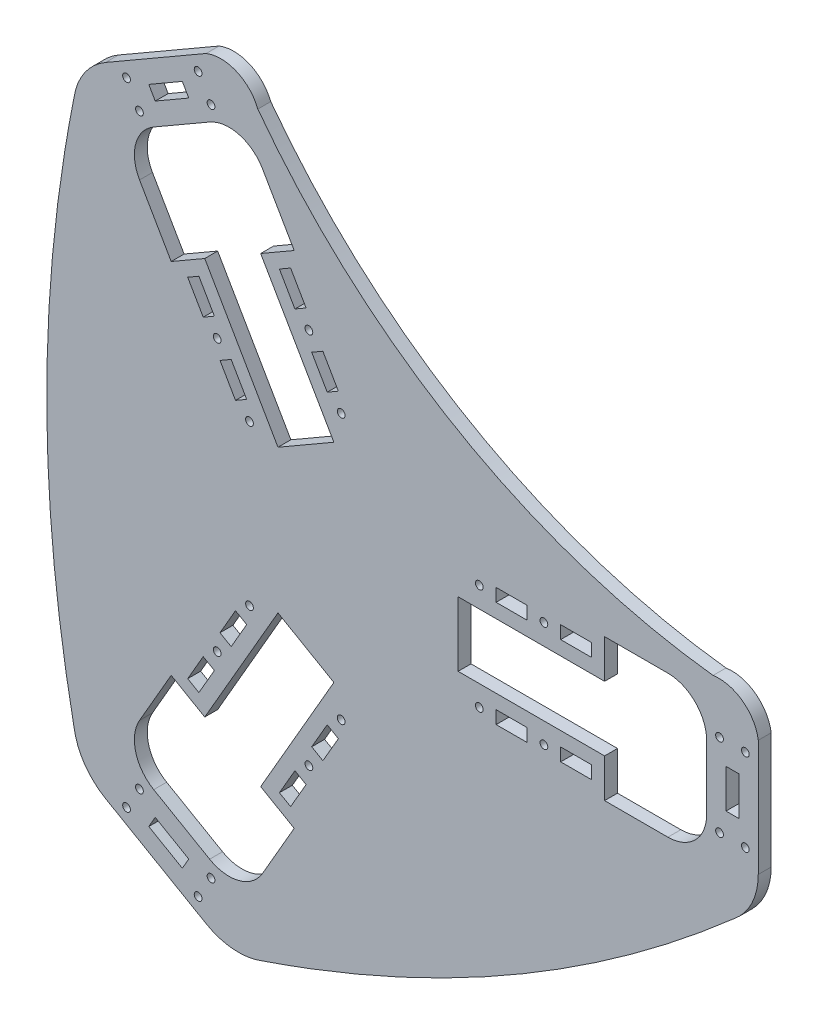
from build123d import *
from build123d.topology import SkipClean

# Parameters (mm, degrees)
BOSS_EXTRUDE1_DEPTH = 5
BOSS_EXTRUDE2_DEPTH = 5
SKETCH4_R           = 1.5
SKETCH4_W           = 21.014084041
SKETCH4_H           = 55
SKETCH4_W_2         = 12
SKETCH4_H_2         = 5
CUT_EXTRUDE1_DEPTH  = 5
CIRPATTERN1_COUNT   = 3
SKETCH5_R           = 188.544827525
CUT_EXTRUDE2_DEPTH  = 5
BOSS_EXTRUDE3_DEPTH = 5
BOSS_EXTRUDE4_DEPTH = 5
BOSS_EXTRUDE5_START = -5
BOSS_EXTRUDE5_DEPTH = 5
CUT_EXTRUDE3_START  = -5
CUT_EXTRUDE3_DEPTH  = 5
SKETCH8_R           = 1.5
SKETCH8_W           = 5
SKETCH8_H           = 15
CUT_EXTRUDE4_DEPTH  = 10
CIRPATTERN2_COUNT   = 3


with BuildPart() as part:
    # Sketch1 → Boss-Extrude1 (new body)
    with BuildSketch(Plane.XY):
        with BuildLine():
            Line((-8.818414939, -40.273942716), (-43.818414939, -100.895720981))
            ThreePointArc((-43.818414939, -100.895720981), (55, -95.262794416), (109.287464972, -12.5))
            Line((109.287464972, -12.5), (39.287464972, -12.5))
            Line((39.287464972, -12.5), (39.287464972, 12.5))
            Line((39.287464972, 12.5), (109.287464972, 12.5))
            ThreePointArc((109.287464972, 12.5), (55, 95.262794416), (-43.818414939, 100.895720981))
            Line((-43.818414939, 100.895720981), (-8.818414939, 40.273942716))
            Line((-8.818414939, 40.273942716), (-30.469050033, 27.773942716))
            Line((-30.469050033, 27.773942716), (-65.469050033, 88.395720981))
            ThreePointArc((-65.469050033, 88.395720981), (-110, 0), (-65.469050033, -88.395720981))
            Line((-65.469050033, -88.395720981), (-30.469050033, -27.773942716))
            Line((-30.469050033, -27.773942716), (-8.818414939, -40.273942716))
        make_face()
    extrude(amount=BOSS_EXTRUDE1_DEPTH)

    # Sketch3 → Boss-Extrude2 (add)
    with BuildSketch(Plane.XY.offset(5)):
        with BuildLine():
            Line((145.507042021, -22.5), (145.507042021, 22.5))
            ThreePointArc((145.507042021, 22.5), (141.113643739, 33.106601718), (130.507042021, 37.5))
            Line((130.507042021, 37.5), (96.507042021, 37.5))
            Line((96.507042021, 37.5), (96.507042021, -37.5))
            Line((96.507042021, -37.5), (130.507042021, -37.5))
            ThreePointArc((130.507042021, -37.5), (141.113643739, -33.106601718), (145.507042021, -22.5))
        make_face()
        with BuildLine():
            Line((120.507042021, -27.5), (106.507042021, -27.5))
            Line((106.507042021, -27.5), (106.507042021, 27.5))
            Line((106.507042021, 27.5), (120.507042021, 27.5))
            ThreePointArc((120.507042021, 27.5), (131.113643739, 23.106601718), (135.507042021, 12.5))
            Line((135.507042021, 12.5), (135.507042021, -12.5))
            ThreePointArc((135.507042021, -12.5), (131.113643739, -23.106601718), (120.507042021, -27.5))
        make_face(mode=Mode.SUBTRACT)
    boss_extrude2 = extrude(amount=-BOSS_EXTRUDE2_DEPTH)

    # Sketch4 → Cut-Extrude1 (cut)
    with BuildSketch(Plane.XY.offset(5)):
        with Locations((72.5, -20.5)):
            Circle(SKETCH4_R)
        with Locations((72.5, 20.5)):
            Circle(SKETCH4_R)
        with Locations((47.5, 20.5)):
            Circle(SKETCH4_R)
        with Locations((47.5, -20.5)):
            Circle(SKETCH4_R)
        with Locations((106.50704202, 0)):
            Rectangle(SKETCH4_W, SKETCH4_H)
        with Locations((85, -20.5)):
            Rectangle(SKETCH4_W_2, SKETCH4_H_2)
        with Locations((60, -20.5)):
            Rectangle(SKETCH4_W_2, SKETCH4_H_2)
        with Locations((85, 20.5)):
            Rectangle(SKETCH4_W_2, SKETCH4_H_2)
        with Locations((60, 20.5)):
            Rectangle(SKETCH4_W_2, SKETCH4_H_2)
    cut_extrude1 = extrude(amount=-CUT_EXTRUDE1_DEPTH, mode=Mode.SUBTRACT)

    # CirPattern1: Boss-Extrude2, Cut-Extrude1 ×3 about axis
    cirpattern1_axis = Axis((0, 0, 5), (0, 0, 1))
    add([boss_extrude2.rotate(cirpattern1_axis, i * 360 / CIRPATTERN1_COUNT) for i in range(1, CIRPATTERN1_COUNT)])
    add([cut_extrude1.rotate(cirpattern1_axis, i * 360 / CIRPATTERN1_COUNT) for i in range(1, CIRPATTERN1_COUNT)], mode=Mode.SUBTRACT)

    # Sketch5 → Cut-Extrude2 (cut)
    with BuildSketch(Plane.XY.offset(5)):
        with Locations((130.507042021, 226.044827525)):
            Circle(SKETCH5_R)
    extrude(amount=-CUT_EXTRUDE2_DEPTH, mode=Mode.SUBTRACT)

    # Sketch5<2> → Boss-Extrude3 (add)
    with SkipClean():  # the faces are left unmerged after this step: merging them gives an invalid solid
        with BuildSketch(Plane.XY.offset(5)):
            with BuildLine():
                ThreePointArc((130.507042021, 37.5), (36.234628258, 62.760217136), (-32.777568368, 131.772413763))
                ThreePointArc((-32.777568368, 131.772413763), (30.05166829, 52.051016331), (130.507042021, 37.5))
            make_face()
        extrude(amount=-BOSS_EXTRUDE3_DEPTH)

    # Sketch6 → Boss-Extrude4 (add)
    with SkipClean():  # the faces are left unmerged after this step: merging them gives an invalid solid
        with BuildSketch(Plane.XY.offset(5)):
            with BuildLine():
                add(Edge.make_bspline(
                    [(141.113643739, -33.106601718), (60.386010005, -104.591637395), (-41.885663749, -138.761301157)],
                    knots=[0, 0, 0, 1, 1, 1], degree=2))
                ThreePointArc((141.113643739, -33.106601718), (27.732185277, -48.033553904), (-41.885663749, -138.761301157))
            make_face()
            with BuildLine():
                ThreePointArc((-99.22797999, -105.654699439), (-55.464370554, 0), (-99.22797999, 105.654699439))
                add(Edge.make_bspline(
                    [(-99.22797999, 105.654699439), (-120.77202001, 0), (-99.22797999, -105.654699439)],
                    knots=[0, 0, 0, 1, 1, 1], degree=2))
            make_face()
        extrude(amount=-BOSS_EXTRUDE4_DEPTH)

    # Sketch7 → Boss-Extrude5 (add)
    with BuildSketch(Plane(origin=(0, 0, 0), x_dir=(-1, 0, 0), z_dir=(0, 0, -1)).offset(BOSS_EXTRUDE5_START)):
        with BuildLine():
            Line((-155.507042021, 22.5), (-155.507042021, -22.5))
            ThreePointArc((-155.507042021, -22.5), (-153.037379973, -33.334383774), (-146.11633228, -42.028186234))
            add(Edge.make_bspline(
                [(36.660689187, -147.55454878), (2.706672335, -136.063921523), (-29.525971209, -121.51723718), (-90.474028791, -86.328859729), (-119.188148744, -65.68791376), (-146.11633228, -42.028186234)],
                knots=[0, 0, 0, 0, 0.5, 0.5, 1, 1, 1, 1], degree=3))
            ThreePointArc((36.660689187, -147.55454878), (47.650266819, -149.201450672), (58.267949425, -145.923048857))
            Line((58.267949425, -145.923048857), (97.239092596, -123.423048857))
            ThreePointArc((97.239092596, -123.423048857), (105.387113153, -115.8670669), (109.455643093, -105.526362548))
            add(Edge.make_bspline(
                [(109.455643093, 105.526362548), (116.48147641, 70.376007764), (120, 35.188377452), (120, -35.188377452), (116.48147641, -70.376007764), (109.455643093, -105.526362548)],
                knots=[0, 0, 0, 0, 0.5, 0.5, 1, 1, 1, 1], degree=3))
            ThreePointArc((109.455643093, 105.526362548), (105.387113153, 115.8670669), (97.239092596, 123.423048857))
            Line((97.239092596, 123.423048857), (58.267949425, 145.923048857))
            ThreePointArc((58.267949425, 145.923048857), (46.474352087, 145.735057462), (38.267949425, 137.262794819))
            ThreePointArc((38.267949425, 137.262794819), (45.767949425, 139.272413763), (53.267949425, 137.262794819))
            Line((53.267949425, 137.262794819), (92.239092596, 114.762794819))
            ThreePointArc((92.239092596, 114.762794819), (97.185203012, 110.144649755), (99.598321301, 103.822614307))
            add(Edge.make_bspline(
                [(99.598321301, -103.822614309), (120.401678699, -1e-09), (99.598321301, 103.822614307)],
                knots=[0, 0, 0, 1, 1, 1], degree=2))
            ThreePointArc((99.598321301, -103.822614309), (97.185203011, -110.144649756), (92.239092596, -114.762794819))
            Line((92.239092596, -114.762794819), (53.267949425, -137.262794819))
            ThreePointArc((53.267949425, -137.262794819), (46.795463273, -139.237179557), (40.113860827, -138.165983575))
            add(Edge.make_bspline(
                [(-139.712182129, -34.343369266), (-60.20083935, -104.270912411), (40.113860827, -138.165983575)],
                knots=[0, 0, 0, 1, 1, 1], degree=2))
            ThreePointArc((-139.712182129, -34.343369266), (-143.980666285, -29.092529802), (-145.507042021, -22.5))
            Line((-145.507042021, -22.5), (-145.507042021, 22.5))
            ThreePointArc((-145.507042021, 22.5), (-143.497423077, 30), (-138.007042021, 35.490381057))
            ThreePointArc((-138.007042021, 35.490381057), (-149.447438028, 32.619559199), (-155.507042021, 22.5))
        make_face()
        with BuildLine():
            ThreePointArc((29.086468731, 125.650289264), (-39.369546298, 68.190054459), (-123.359576861, 37.635523805))
            ThreePointArc((-123.359576861, 37.635523805), (-36.234628258, 62.760217136), (29.086468731, 125.650289264))
        make_face()
    extrude(amount=BOSS_EXTRUDE5_DEPTH)

    # Sketch7<3> → Cut-Extrude3 (cut)
    with BuildSketch(Plane(origin=(0, 0, 0), x_dir=(-1, 0, 0), z_dir=(0, 0, -1)).offset(CUT_EXTRUDE3_START)):
        with BuildLine():
            ThreePointArc((-130.507042021, 37.5), (-134.389327697, 36.988887394), (-138.007042021, 35.490381057))
            ThreePointArc((-138.007042021, 35.490381057), (-130.667867293, 36.457510349), (-123.359576861, 37.635523805))
            ThreePointArc((-123.359576861, 37.635523805), (-126.932667079, 37.533883996), (-130.507042021, 37.5))
        make_face()
        with BuildLine():
            ThreePointArc((32.777568368, 131.772413763), (30.961036496, 128.693856258), (29.086468731, 125.650289264))
            ThreePointArc((29.086468731, 125.650289264), (33.760803526, 131.390447709), (38.267949425, 137.262794819))
            ThreePointArc((38.267949425, 137.262794819), (35.161347707, 134.87901548), (32.777568368, 131.772413763))
        make_face()
    extrude(amount=CUT_EXTRUDE3_DEPTH, mode=Mode.SUBTRACT)

    # Sketch8 → Cut-Extrude4 (cut)
    with BuildSketch(Plane(origin=(0, 0, 0), x_dir=(-1, 0, 0), z_dir=(0, 0, -1))):
        with Locations((-140.507042021, 16)):
            Circle(SKETCH8_R)
        with Locations((-140.507042021, -16)):
            Circle(SKETCH8_R)
        with Locations((-150.507042021, -16)):
            Circle(SKETCH8_R)
        with Locations((-150.507042021, 16)):
            Circle(SKETCH8_R)
        with Locations((-145.507042021, 0)):
            Rectangle(SKETCH8_W, SKETCH8_H)
    cut_extrude4 = extrude(amount=-CUT_EXTRUDE4_DEPTH, mode=Mode.SUBTRACT)

    # CirPattern2: Cut-Extrude4 ×3 about axis
    cirpattern2_axis = Axis((0, 0, 0), (0, 0, -1))
    for i in range(1, CIRPATTERN2_COUNT):
        add(cut_extrude4.rotate(cirpattern2_axis, i * 360 / CIRPATTERN2_COUNT), mode=Mode.SUBTRACT)


solid = part.part
